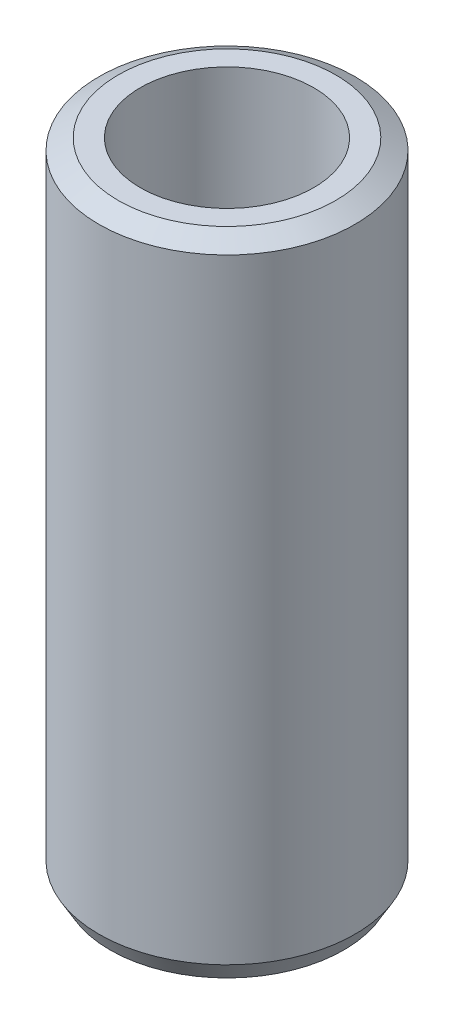
from build123d import *
from OCP.BRepFilletAPI import BRepFilletAPI_MakeChamfer

# Parameters (mm, degrees)
SKETCH1_R           = 57.5
BOSS_EXTRUDE1_DEPTH = 289.758508634
SKETCH2_R           = 38.949051122
CUT_EXTRUDE1_DEPTH  = 301.952642995
CHAMFER1_SIZE       = 4.985275751
CHAMFER1_SIZE2      = 8.634750891


with BuildPart() as part:
    # Sketch1 → Boss-Extrude1 (new body)
    with BuildSketch(Plane(origin=(0, 0, 0), x_dir=(1, 0, 0), z_dir=(0, 1, 0))):
        Circle(SKETCH1_R)
    extrude(amount=BOSS_EXTRUDE1_DEPTH)

    # Sketch2 → Cut-Extrude1 (cut, through all)
    with BuildSketch(Plane(origin=(0, 0, 0), x_dir=(1, 0, 0), z_dir=(0, 1, 0))):
        Circle(SKETCH2_R)
    extrude(amount=CUT_EXTRUDE1_DEPTH, mode=Mode.SUBTRACT)

    # Chamfer1: one chamfer whose edges measure the first distance from different faces: ONE call of the kernel's chamfer builder (chamfer() names one face for all edges)
    chamfer1_edges_1 = [part.edges().sort_by_distance(p)[0] for p in [
        (-57.5, 289.758508634, 0),
    ]]
    chamfer1_side_1 = [part.faces().sort_by_distance(p)[0] for p in [
        (-57.5, 144.879254317, 0),
    ]]
    chamfer1_edges_2 = [part.edges().sort_by_distance(p)[0] for p in [
        (-57.5, 0, 0),
    ]]
    chamfer1_side_2 = [part.faces().sort_by_distance(p)[0] for p in [
        (-55.873654403, 0, 0),
    ]]
    chamfer1 = BRepFilletAPI_MakeChamfer(part.part.solid().wrapped)
    for e in chamfer1_edges_1:
        chamfer1.Add(CHAMFER1_SIZE, CHAMFER1_SIZE2, e.wrapped, chamfer1_side_1[0].wrapped)  # the first distance lies on this face
    for e in chamfer1_edges_2:
        chamfer1.Add(CHAMFER1_SIZE, CHAMFER1_SIZE2, e.wrapped, chamfer1_side_2[0].wrapped)  # the first distance lies on this face
    add(Compound.cast(chamfer1.Shape()), mode=Mode.REPLACE)


solid = part.part
